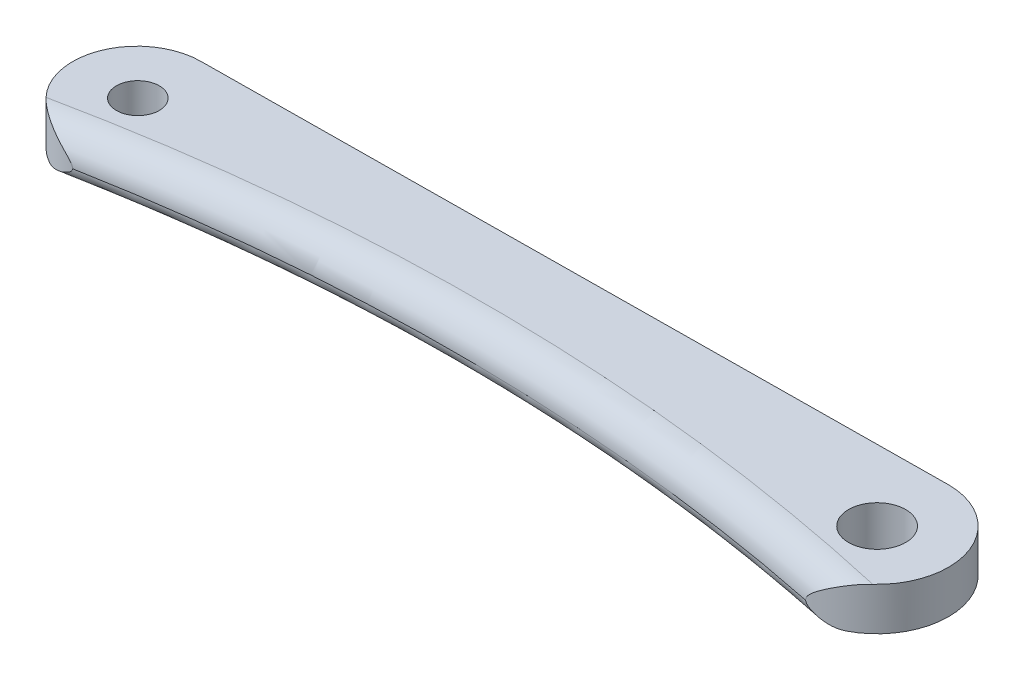
from build123d import *

# Parameters (mm, degrees)
BOSS_EXTRUDE1_OUTLINE_R = 2
BOSS_EXTRUDE1_DEPTH     = 3
CUT_EXTRUDE2_DEPTH      = 3
CUT_EXTRUDE3_DEPTH      = 58.098511364
FILLET1_R               = 2
FILLET2_R               = 1


# Read off the part's stored shape, not the designer's step: Boss-Extrude1
with BuildPart() as part:
    # Boss-Extrude1 outline → Boss-Extrude1 (new body)
    with BuildSketch(Plane(origin=(0, 0, 0), x_dir=(1, 0, 0), z_dir=(0, 1, 0))):
        with BuildLine():
            ThreePointArc((0, 4.5), (-4.5, 0), (0, -4.5))
            Line((0, -4.5), (51.8, -5))
            ThreePointArc((51.8, -5), (56.8, 0), (51.8, 5))
            Line((51.8, 5), (0, 4.5))
        make_face()
        with Locations((51.8, 0)):
            Circle(BOSS_EXTRUDE1_OUTLINE_R, mode=Mode.SUBTRACT)
    extrude(amount=BOSS_EXTRUDE1_DEPTH)

    # Sketch4 → Cut-Extrude2 (cut)
    with BuildSketch(Plane(origin=(0, 0, 0), x_dir=(-1, 0, 0), z_dir=(0, -1, 0))):
        with BuildLine():
            Line((0, 1.563625245), (0, 0))
            Line((0, 0), (0, -1.436374754))
            ThreePointArc((0, -1.436374754), (1.060634912, -0.997021111), (1.499960925, 0.063625245))
            ThreePointArc((1.499960925, 0.063625245), (1.060634912, 1.124271602), (0, 1.563625245))
        make_face()
        with BuildLine():
            Line((-1.498689077, 0), (0, 0))
            Line((0, 0), (0, 1.563625245))
            ThreePointArc((0, 1.563625245), (-1.082947037, 1.101560863), (-1.498689077, 0))
        make_face()
        with BuildLine():
            Line((0, -1.436374754), (0, 0))
            Line((0, 0), (-1.498689077, 0))
            ThreePointArc((-1.498689077, 0), (-1.037946482, -1.019309755), (0, -1.436374754))
        make_face()
        with BuildLine():
            Line((-1.498689077, 0), (0, 0))
            Line((0, 0), (0, 1.563625245))
            ThreePointArc((0, 1.563625245), (-1.082947037, 1.101560863), (-1.498689077, 0))
        make_face()
    extrude(amount=-CUT_EXTRUDE2_DEPTH, mode=Mode.SUBTRACT)

    # Sketch5 → Cut-Extrude3 (cut, through all)
    with BuildSketch(Plane.XZ):
        with BuildLine():
            Line((51.8, 5), (25.9, 4.75))
            Line((25.9, 4.75), (25.9, 2.25))
            ThreePointArc((25.9, 2.25), (38.916262453, 3.000928167), (51.8, 5))
        make_face()
        with BuildLine():
            Line((25.9, 2.25), (25.9, 4.75))
            Line((25.9, 4.75), (0, 4.5))
            ThreePointArc((0, 4.5), (12.89588572, 2.752084515), (25.9, 2.25))
        make_face()
        with BuildLine():
            Line((51.8, 5), (25.9, 4.75))
            Line((25.9, 4.75), (25.9, 2.25))
            ThreePointArc((25.9, 2.25), (38.916262453, 3.000928167), (51.8, 5))
        make_face()
        with BuildLine():
            Line((25.9, 2.25), (25.9, 4.75))
            Line((25.9, 4.75), (0, 4.5))
            ThreePointArc((0, 4.5), (12.89588572, 2.752084515), (25.9, 2.25))
        make_face()
    extrude(amount=-CUT_EXTRUDE3_DEPTH, mode=Mode.SUBTRACT)

    # Fillet1
    fillet1_edges = [part.edges().sort_by_distance(p)[0] for p in [
        (25.924129047, 3, 2.250230756),
    ]]
    fillet(fillet1_edges, radius=FILLET1_R)

    # Fillet2
    fillet2_edges = [part.edges().sort_by_distance(p)[0] for p in [
        (25.924129047, 0, 2.250230756),
    ]]
    fillet(fillet2_edges, radius=FILLET2_R - 0.0001)  # a hair under: the kernel refuses the full size


solid = part.part
